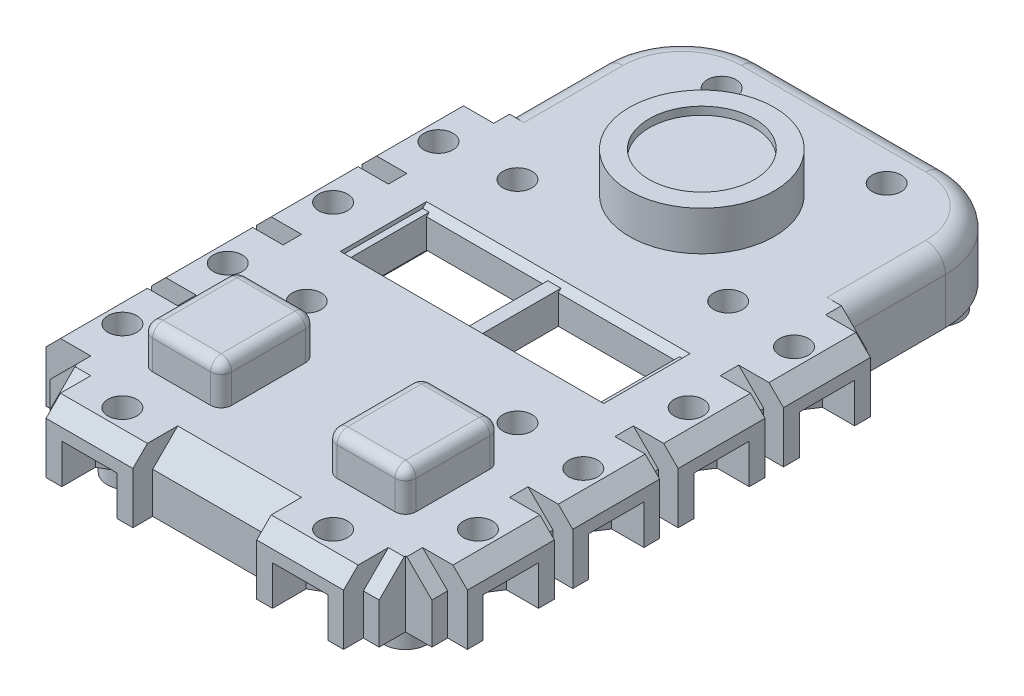
from build123d import *

# Parameters (mm, degrees)
SKETCH1_W            = 32
SKETCH1_H            = 50
BOSS_EXTRUDE1_DEPTH  = 2.5
CUT_EXTRUDE1_DEPTH   = 10
SKETCH5_R            = 1.1
CUT_EXTRUDE2_DEPTH   = 10
CHAMFER1_SIZE        = 1.1
FILLET1_R            = 1.5
CHAMFER2_SIZE        = 1.9
SKETCH6_R            = 1.1
CUT_EXTRUDE3_DEPTH   = 4
SKETCH7_W            = 6
SKETCH7_H            = 7.2
BOSS_EXTRUDE2_DEPTH  = 3
FILLET2_R            = 0.8
SKETCH8_R            = 5.5
BOSS_EXTRUDE3_DEPTH  = 3
SKETCH9_R            = 4
CUT_EXTRUDE4_DEPTH   = 0.6
SKETCH10_W           = 9
SKETCH10_H           = 4.15
CUT_EXTRUDE5_DEPTH   = 31.099833887
SKETCH11_W           = 20
SKETCH11_H           = 4.15
CUT_EXTRUDE6_DEPTH   = 0.3
CHAMFER3_SIZE        = 1.2
CUT_EXTRUDE7_DEPTH   = 1.5
CUT_EXTRUDE8_REACH   = 32.741
LPATTERN1_COUNT      = 4
LPATTERN1_PITCH      = 8
CUT_EXTRUDE9_DEPTH   = 1.55
CUT_EXTRUDE10_REACH  = 32.741
MIRROR2_COPY_1_DEPTH = 1.5
MIRROR2_COPY_2_DEPTH = 1.5
MIRROR2_COPY_3_DEPTH = 1.5
MIRROR2_COPY_4_REACH = 32.741
MIRROR2_COPY_5_REACH = 32.741
MIRROR2_COPY_6_REACH = 32.741
SKETCH16_R           = 1.715
CUT_EXTRUDE11_DEPTH  = 4.5
SKETCH17_R           = 3.25
BOSS_EXTRUDE4_DEPTH  = 3
SKETCH18_W           = 3.4
SKETCH18_H           = 4.6
CUT_EXTRUDE12_DEPTH  = 3
SKETCH20_R           = 3.35
SKETCH20_R_2         = 2.4
BOSS_EXTRUDE5_DEPTH  = 3
SKETCH21_W           = 21
SKETCH21_H           = 8.35
SKETCH21_W_2         = 9
SKETCH21_H_2         = 5.55
BOSS_EXTRUDE6_DEPTH  = 2.2
SKETCH22_R           = 1.65
BOSS_EXTRUDE7_DEPTH  = 6.5
SKETCH23_R           = 1.15
CUT_EXTRUDE13_DEPTH  = 5


with BuildPart() as part:
    # Sketch1 → Boss-Extrude1 (new, symmetric)
    with BuildSketch(Plane(origin=(0, 0, 0), x_dir=(1, 0, 0), z_dir=(0, 1, 0))):
        Rectangle(SKETCH1_W, SKETCH1_H)
    extrude(amount=BOSS_EXTRUDE1_DEPTH, both=True)

    # Sketch4 → Cut-Extrude1 (cut)
    with BuildSketch(Plane(origin=(0, 2.5, 0), x_dir=(1, 0, 0), z_dir=(0, 1, 0))):
        with BuildLine():
            Line((-13, 19), (-13, 11.5))
            Line((-13, 11.5), (-14.5, 11.5))
            Line((-14.5, 11.5), (-14.5, 10.3))
            Line((-14.5, 10.3), (-16, 10.3))
            Line((-16, 10.3), (-16, 3.7))
            Line((-16, 3.7), (-14.5, 3.7))
            Line((-14.5, 3.7), (-14.5, 2.3))
            Line((-14.5, 2.3), (-16, 2.3))
            Line((-16, 2.3), (-16, -4.3))
            Line((-16, -4.3), (-14.5, -4.3))
            Line((-14.5, -4.3), (-14.5, -5.7))
            Line((-14.5, -5.7), (-16, -5.7))
            Line((-16, -5.7), (-16, -12.3))
            Line((-16, -12.3), (-14.5, -12.3))
            Line((-14.5, -12.3), (-14.5, -13.7))
            Line((-14.5, -13.7), (-16, -13.7))
            Line((-16, -13.7), (-16, -20.3))
            Line((-16, -20.3), (-14.5, -20.3))
            Line((-14.5, -20.3), (-14.5, -21.5))
            Line((-14.5, -21.5), (-12.5, -21.5))
            Line((-12.5, -21.5), (-12.5, -23.5))
            Line((-12.5, -23.5), (-11.3, -23.5))
            Line((-11.3, -23.5), (-11.3, -25))
            Line((-11.3, -25), (-4.7, -25))
            Line((-4.7, -25), (-4.7, -23.5))
            Line((-4.7, -23.5), (0, -23.5))
            Line((0, -23.5), (0, -26))
            Line((0, -26), (-20, -26))
            Line((-20, -26), (-20, 25))
            Line((-20, 25), (-7, 25))
            ThreePointArc((-7, 25), (-11.242640687, 23.242640687), (-13, 19))
        make_face()
    cut_extrude1 = extrude(amount=-CUT_EXTRUDE1_DEPTH, mode=Mode.SUBTRACT)

    # Mirror1: Cut-Extrude1 across plane
    add(cut_extrude1.mirror(Plane(origin=(0, 0, 0), x_dir=(0, 0, 1), z_dir=(1, 0, 0))), mode=Mode.SUBTRACT)

    # Sketch5 → Cut-Extrude2 (cut)
    with BuildSketch(Plane(origin=(0, 2.5, 0), x_dir=(1, 0, 0), z_dir=(0, 1, 0))):
        with Locations(Location((-13.5, 7, 0), (0, 0, 270))):
            Circle(SKETCH5_R)
        with Locations(Location((13.5, 7, 0), (0, 0, 270))):
            Circle(SKETCH5_R)
        with Locations(Location((13.5, -1, 0), (0, 0, 270))):
            Circle(SKETCH5_R)
        with Locations(Location((13.5, -9, 0), (0, 0, 270))):
            Circle(SKETCH5_R)
        with Locations(Location((13.5, -17, 0), (0, 0, 270))):
            Circle(SKETCH5_R)
        with Locations(Location((-13.5, -1, 0), (0, 0, 270))):
            Circle(SKETCH5_R)
        with Locations(Location((-13.5, -9, 0), (0, 0, 270))):
            Circle(SKETCH5_R)
        with Locations(Location((-13.5, -17, 0), (0, 0, 270))):
            Circle(SKETCH5_R)
        with Locations(Location((-8, -22.5, 0), (0, 0, 270))):
            Circle(SKETCH5_R)
        with Locations(Location((8, -22.5, 0), (0, 0, 270))):
            Circle(SKETCH5_R)
    extrude(amount=-CUT_EXTRUDE2_DEPTH, mode=Mode.SUBTRACT)

    # Chamfer1
    chamfer1_edges = [part.edges().sort_by_distance(p)[0] for p in [
        (8, 2.5, 25),
        (16, 2.5, 17),
        (16, 2.5, 9),
        (16, 2.5, 1),
        (16, 2.5, -7),
        (-16, 2.5, -7),
        (-16, 2.5, 1),
        (-16, 2.5, 9),
        (-16, 2.5, 17),
        (-8, 2.5, 25),
    ]]
    chamfer(chamfer1_edges, length=CHAMFER1_SIZE)

    # Fillet1
    fillet1_edges = [part.edges().sort_by_distance(p)[0] for p in [
        (0, 2.5, -25),
        (13, 2.5, -15.25),
        (11.242640687, 2.5, -23.242640687),
        (-13, 2.5, -15.25),
        (-11.242640687, 2.5, -23.242640687),
    ]]
    fillet(fillet1_edges, radius=FILLET1_R)

    # Chamfer2
    chamfer2_edges = [part.edges().sort_by_distance(p)[0] for p in [
        (11.9, 2.5, 23.5),
        (14.5, 2.5, 20.9),
        (14.5, 2.5, 13),
        (14.5, 2.5, 5),
        (14.5, 2.5, -3),
        (14.5, 2.5, -10.9),
        (-14.5, 2.5, -10.9),
        (-14.5, 2.5, -3),
        (-14.5, 2.5, 5),
        (-14.5, 2.5, 13),
        (-11.9, 2.5, 23.5),
        (-14.5, 2.5, 20.9),
        (0, 2.5, 23.5),
    ]]
    chamfer(chamfer2_edges, length=CHAMFER2_SIZE)

    # Sketch6 → Cut-Extrude3 (cut)
    with BuildSketch(Plane(origin=(0, 2.5, 0), x_dir=(1, 0, 0), z_dir=(0, 1, 0))):
        with Locations(Location((-6.265, 21.27, 0), (0, 0, 270))):
            Circle(SKETCH6_R)
        with Locations(Location((6.265, 21.27, 0), (0, 0, 270))):
            Circle(SKETCH6_R)
        with Locations(Location((-8, 7.5, 0), (0, 0, 270))):
            Circle(SKETCH6_R)
        with Locations(Location((8, 7.5, 0), (0, 0, 270))):
            Circle(SKETCH6_R)
        with Locations(Location((8, -8.5, 0), (0, 0, 270))):
            Circle(SKETCH6_R)
        with Locations(Location((-8, -8.5, 0), (0, 0, 270))):
            Circle(SKETCH6_R)
    extrude(amount=-CUT_EXTRUDE3_DEPTH, mode=Mode.SUBTRACT)

    # Sketch7 → Boss-Extrude2 (add)
    with BuildSketch(Plane(origin=(0, 2.5, 0), x_dir=(1, 0, 0), z_dir=(0, 1, 0))):
        with Locations((-7, -15.4)):
            Rectangle(SKETCH7_W, SKETCH7_H)
        with Locations((7, -15.4)):
            Rectangle(SKETCH7_W, SKETCH7_H)
    extrude(amount=BOSS_EXTRUDE2_DEPTH)

    # Fillet2
    fillet2_edges = [part.edges().sort_by_distance(p)[0] for p in [
        (-10, 4, 11.8),
        (-10, 4, 19),
        (-4, 4, 19),
        (-4, 4, 11.8),
        (-10, 5.5, 15.4),
        (-7, 5.5, 19),
        (-4, 5.5, 15.4),
        (-7, 5.5, 11.8),
        (4, 4, 11.8),
        (4, 4, 19),
        (10, 4, 19),
        (10, 4, 11.8),
        (4, 5.5, 15.4),
        (7, 5.5, 19),
        (10, 5.5, 15.4),
        (7, 5.5, 11.8),
    ]]
    fillet(fillet2_edges, radius=FILLET2_R)

    # Sketch8 → Boss-Extrude3 (add)
    with BuildSketch(Plane(origin=(0, 2.5, 0), x_dir=(1, 0, 0), z_dir=(0, 1, 0))):
        with Locations(Location((0, 13.5, 0), (0, 0, 90))):
            Circle(SKETCH8_R)
    extrude(amount=BOSS_EXTRUDE3_DEPTH)

    # Sketch9 → Cut-Extrude4 (cut)
    with BuildSketch(Plane(origin=(0, 5.5, 0), x_dir=(1, 0, 0), z_dir=(0, 1, 0))):
        with Locations(Location((0, 13.5, 0), (0, 0, 270))):
            Circle(SKETCH9_R)
    extrude(amount=-CUT_EXTRUDE4_DEPTH, mode=Mode.SUBTRACT)

    # Sketch10 → Cut-Extrude5 (cut, through all)
    with BuildSketch(Plane(origin=(0, 2.5, 0), x_dir=(1, 0, 0), z_dir=(0, 1, 0))):
        with Locations((-5, -0.675)):
            Rectangle(SKETCH10_W, SKETCH10_H)
        with Locations((5, -0.675)):
            Rectangle(SKETCH10_W, SKETCH10_H)
    extrude(amount=-CUT_EXTRUDE5_DEPTH, mode=Mode.SUBTRACT)

    # Sketch11 → Cut-Extrude6 (cut)
    with BuildSketch(Plane(origin=(0, 2.5, 0), x_dir=(1, 0, 0), z_dir=(0, 1, 0))):
        with Locations((0, -0.675)):
            Rectangle(SKETCH11_W, SKETCH11_H)
    extrude(amount=-CUT_EXTRUDE6_DEPTH, mode=Mode.SUBTRACT)

    # Chamfer3
    # the kernel refuses this chamfer: 1.2 mm, written as the material it takes off along each edge
    with BuildSketch(Plane(origin=(10, 2.5, 2.75), x_dir=(0, 0.027495876610586275, 0.9996219169112968), z_dir=(-1, 0, 0))) as chamfer3_piece_1_section:
        Polygon((CHAMFER3_SIZE * 0.999621916911, -CHAMFER3_SIZE * 0.0274958766106), (-CHAMFER3_SIZE * 0.0274958766106, -CHAMFER3_SIZE * 0.999621916911), (0, 0), align=None)
    chamfer3_piece_1 = extrude(amount=20, mode=Mode.PRIVATE)
    chamfer3_piece_1 = split(chamfer3_piece_1, bisect_by=Plane(origin=(9.75, 2.2, 3.278571429), z_dir=(0, 1, 0)), keep=Keep.TOP, mode=Mode.PRIVATE)
    add(chamfer3_piece_1, mode=Mode.SUBTRACT)
    with BuildSketch(Plane(origin=(13.086019586, 2.5, 2.75), x_dir=(0, 0.027495876610586275, 0.9996219169112968), z_dir=(-1, 0, 0))) as chamfer3_piece_2_section:
        Polygon((CHAMFER3_SIZE * 0.999621916911, -CHAMFER3_SIZE * 0.0274958766106), (-CHAMFER3_SIZE * 0.0274958766106, -CHAMFER3_SIZE * 0.999621916911), (0, 0), align=None)
    chamfer3_piece_2 = extrude(amount=26.172039171, mode=Mode.PRIVATE)
    chamfer3_piece_2 = split(chamfer3_piece_2, bisect_by=Plane(origin=(9.5, 1.9, 3.05), z_dir=(-1, 0, 0)), keep=Keep.TOP, mode=Mode.PRIVATE)
    chamfer3_piece_2 = split(chamfer3_piece_2, bisect_by=Plane(origin=(0.5, 1.9, 3.05), z_dir=(1, 0, 0)), keep=Keep.TOP, mode=Mode.PRIVATE)
    add(chamfer3_piece_2, mode=Mode.SUBTRACT)
    with BuildSketch(Plane(origin=(13.086019586, 2.5, 2.75), x_dir=(0, 0.027495876610586275, 0.9996219169112968), z_dir=(-1, 0, 0))) as chamfer3_piece_3_section:
        Polygon((CHAMFER3_SIZE * 0.999621916911, -CHAMFER3_SIZE * 0.0274958766106), (-CHAMFER3_SIZE * 0.0274958766106, -CHAMFER3_SIZE * 0.999621916911), (0, 0), align=None)
    chamfer3_piece_3 = extrude(amount=26.172039171, mode=Mode.PRIVATE)
    chamfer3_piece_3 = split(chamfer3_piece_3, bisect_by=Plane(origin=(-0.5, 1.9, 3.05), z_dir=(-1, 0, 0)), keep=Keep.TOP, mode=Mode.PRIVATE)
    chamfer3_piece_3 = split(chamfer3_piece_3, bisect_by=Plane(origin=(-9.5, 1.9, 3.05), z_dir=(1, 0, 0)), keep=Keep.TOP, mode=Mode.PRIVATE)
    add(chamfer3_piece_3, mode=Mode.SUBTRACT)
    with BuildSketch(Plane(origin=(-10, 2.5, -1.4), x_dir=(0, 0.027495876610586275, -0.9996219169112968), z_dir=(1, 0, 0))) as chamfer3_piece_4_section:
        Polygon((CHAMFER3_SIZE * 0.999621916911, -CHAMFER3_SIZE * 0.0274958766106), (-CHAMFER3_SIZE * 0.0274958766106, -CHAMFER3_SIZE * 0.999621916911), (0, 0), align=None)
    chamfer3_piece_4 = extrude(amount=20, mode=Mode.PRIVATE)
    chamfer3_piece_4 = split(chamfer3_piece_4, bisect_by=Plane(origin=(-9.75, 2.2, -2.4), z_dir=(0, 1, 0)), keep=Keep.TOP, mode=Mode.PRIVATE)
    add(chamfer3_piece_4, mode=Mode.SUBTRACT)
    with BuildSketch(Plane(origin=(-13.086019586, 2.5, -1.4), x_dir=(0, 0.027495876610586275, -0.9996219169112968), z_dir=(1, 0, 0))) as chamfer3_piece_5_section:
        Polygon((CHAMFER3_SIZE * 0.999621916911, -CHAMFER3_SIZE * 0.0274958766106), (-CHAMFER3_SIZE * 0.0274958766106, -CHAMFER3_SIZE * 0.999621916911), (0, 0), align=None)
    chamfer3_piece_5 = extrude(amount=26.172039171, mode=Mode.PRIVATE)
    chamfer3_piece_5 = split(chamfer3_piece_5, bisect_by=Plane(origin=(-0.5, 1.9, -1.7), z_dir=(-1, 0, 0)), keep=Keep.TOP, mode=Mode.PRIVATE)
    chamfer3_piece_5 = split(chamfer3_piece_5, bisect_by=Plane(origin=(-9.5, 1.9, -1.7), z_dir=(1, 0, 0)), keep=Keep.TOP, mode=Mode.PRIVATE)
    add(chamfer3_piece_5, mode=Mode.SUBTRACT)
    with BuildSketch(Plane(origin=(-13.086019586, 2.5, -1.4), x_dir=(0, 0.027495876610586275, -0.9996219169112968), z_dir=(1, 0, 0))) as chamfer3_piece_6_section:
        Polygon((CHAMFER3_SIZE * 0.999621916911, -CHAMFER3_SIZE * 0.0274958766106), (-CHAMFER3_SIZE * 0.0274958766106, -CHAMFER3_SIZE * 0.999621916911), (0, 0), align=None)
    chamfer3_piece_6 = extrude(amount=26.172039171, mode=Mode.PRIVATE)
    chamfer3_piece_6 = split(chamfer3_piece_6, bisect_by=Plane(origin=(9.5, 1.9, -1.7), z_dir=(-1, 0, 0)), keep=Keep.TOP, mode=Mode.PRIVATE)
    chamfer3_piece_6 = split(chamfer3_piece_6, bisect_by=Plane(origin=(0.5, 1.9, -1.7), z_dir=(1, 0, 0)), keep=Keep.TOP, mode=Mode.PRIVATE)
    add(chamfer3_piece_6, mode=Mode.SUBTRACT)

    # Sketch12 → Cut-Extrude7 (cut)
    with BuildSketch(Plane(origin=(0, 0.5, 0), x_dir=(1, 0, 0), z_dir=(0, 1, 0))):
        Polygon((-12.287564435, 9.1), (-14.712435565, 9.1), (-17.712435565, 9.1), (-17.712435565, 4.9), (-14.712435565, 4.9), (-12.287564435, 4.9), (-11.075128869, 7), align=None)
    cut_extrude7 = extrude(amount=-CUT_EXTRUDE7_DEPTH, mode=Mode.SUBTRACT)

    # Sketch13 → Cut-Extrude8 (cut, up to next)
    with BuildSketch(Plane.XZ.offset(2.5), mode=Mode.PRIVATE) as cut_extrude8_sk1:
        with BuildLine():
            Line((-16, -4.9), (-13.442264973, -4.9))
            Line((-13.442264973, -4.9), (-12.547372056, -6.45))
            ThreePointArc((-12.547372056, -6.45), (-12.400415486, -7.030230734), (-12.579030386, -7.601510574))
            Line((-12.579030386, -7.601510574), (-13.557735027, -9.1))
            Line((-13.557735027, -9.1), (-16, -9.1))
            Line((-16, -9.1), (-16, -4.9))
        make_face()
    cut_extrude8_tool1 = extrude(cut_extrude8_sk1.sketch, amount=-CUT_EXTRUDE8_REACH, mode=Mode.PRIVATE) & part.part
    cut_extrude8 = cut_extrude8_tool1.solids().sort_by_distance((-14.416857, -2.5, -6.989337))[0]
    add(cut_extrude8, mode=Mode.SUBTRACT)

    # LPattern1: Cut-Extrude7, Cut-Extrude8 ×4
    with Locations(*[(0, 0, i * LPATTERN1_PITCH) for i in range(1, LPATTERN1_COUNT)]):
        add(cut_extrude7, mode=Mode.SUBTRACT)
        add(cut_extrude8, mode=Mode.SUBTRACT)

    # Sketch14 → Cut-Extrude9 (cut)
    with BuildSketch(Plane(origin=(0, 0.5, 0), x_dir=(1, 0, 0), z_dir=(0, 1, 0))):
        Polygon((-5.9, -23.712435565), (-5.9, -21.287564435), (-8, -20.075128869), (-10.1, -21.287564435), (-10.1, -23.712435565), (-10.1, -26.712435565), (-5.9, -26.712435565), align=None)
    cut_extrude9 = extrude(amount=-CUT_EXTRUDE9_DEPTH, mode=Mode.SUBTRACT)

    # Sketch15 → Cut-Extrude10 (cut, up to next)
    with BuildSketch(Plane.XZ.offset(2.5), mode=Mode.PRIVATE) as cut_extrude10_sk1:
        with BuildLine():
            Line((-10.1, 25), (-5.9, 25))
            Line((-5.9, 25), (-5.9, 22.442264973))
            Line((-5.9, 22.442264973), (-7.45, 21.547372056))
            ThreePointArc((-7.45, 21.547372056), (-8, 21.4), (-8.55, 21.547372056))
            Line((-8.55, 21.547372056), (-10.1, 22.442264973))
            Line((-10.1, 22.442264973), (-10.1, 25))
        make_face()
    cut_extrude10_tool1 = extrude(cut_extrude10_sk1.sketch, amount=-CUT_EXTRUDE10_REACH, mode=Mode.PRIVATE) & part.part
    cut_extrude10 = cut_extrude10_tool1.solids().sort_by_distance((-8, -2.5, 23.408677))[0]
    add(cut_extrude10, mode=Mode.SUBTRACT)

    # Mirror2: Cut-Extrude7, Cut-Extrude8, Cut-Extrude9, Cut-Extrude10 across plane
    add(cut_extrude7.mirror(Plane(origin=(0, 0, 0), x_dir=(0, 0, 1), z_dir=(1, 0, 0))), mode=Mode.SUBTRACT)
    add(cut_extrude8.mirror(Plane(origin=(0, 0, 0), x_dir=(0, 0, 1), z_dir=(1, 0, 0))), mode=Mode.SUBTRACT)
    add(cut_extrude9.mirror(Plane(origin=(0, 0, 0), x_dir=(0, 0, 1), z_dir=(1, 0, 0))), mode=Mode.SUBTRACT)
    add(cut_extrude10.mirror(Plane(origin=(0, 0, 0), x_dir=(0, 0, 1), z_dir=(1, 0, 0))), mode=Mode.SUBTRACT)

    # Mirror2 copy 1 sketch → Mirror2 copy 1 (cut)
    with BuildSketch(Plane(origin=(0, 0.5, 8), x_dir=(-1, 0, 0), z_dir=(0, 1, 0))):
        Polygon((-12.287564435, -9.1), (-14.712435565, -9.1), (-17.712435565, -9.1), (-17.712435565, -4.9), (-14.712435565, -4.9), (-12.287564435, -4.9), (-11.075128869, -7), align=None)
    extrude(amount=-MIRROR2_COPY_1_DEPTH, mode=Mode.SUBTRACT)

    # Mirror2 copy 2 sketch → Mirror2 copy 2 (cut)
    with BuildSketch(Plane(origin=(0, 0.5, 16), x_dir=(-1, 0, 0), z_dir=(0, 1, 0))):
        Polygon((-12.287564435, -9.1), (-14.712435565, -9.1), (-17.712435565, -9.1), (-17.712435565, -4.9), (-14.712435565, -4.9), (-12.287564435, -4.9), (-11.075128869, -7), align=None)
    extrude(amount=-MIRROR2_COPY_2_DEPTH, mode=Mode.SUBTRACT)

    # Mirror2 copy 3 sketch → Mirror2 copy 3 (cut)
    with BuildSketch(Plane(origin=(0, 0.5, 24), x_dir=(-1, 0, 0), z_dir=(0, 1, 0))):
        Polygon((-12.287564435, -9.1), (-14.712435565, -9.1), (-17.712435565, -9.1), (-17.712435565, -4.9), (-14.712435565, -4.9), (-12.287564435, -4.9), (-11.075128869, -7), align=None)
    extrude(amount=-MIRROR2_COPY_3_DEPTH, mode=Mode.SUBTRACT)

    # Mirror2 copy 4 sketch → Mirror2 copy 4 (cut, up to next)
    with BuildSketch(Plane(origin=(0, -2.5, 8), x_dir=(-1, 0, 0), z_dir=(0, -1, 0)), mode=Mode.PRIVATE) as mirror2_copy_4_sk1:
        with BuildLine():
            Line((-16, 4.9), (-13.442264973, 4.9))
            Line((-13.442264973, 4.9), (-12.547372056, 6.45))
            ThreePointArc((-12.547372056, 6.45), (-12.400415486, 7.030230734), (-12.579030386, 7.601510574))
            Line((-12.579030386, 7.601510574), (-13.557735027, 9.1))
            Line((-13.557735027, 9.1), (-16, 9.1))
            Line((-16, 9.1), (-16, 4.9))
        make_face()
    mirror2_copy_4_tool1 = extrude(mirror2_copy_4_sk1.sketch, amount=-MIRROR2_COPY_4_REACH, mode=Mode.PRIVATE) & part.part
    add(mirror2_copy_4_tool1.solids().sort_by_distance((14.416857, -2.5, 1.010663))[0], mode=Mode.SUBTRACT)

    # Mirror2 copy 5 sketch → Mirror2 copy 5 (cut, up to next)
    with BuildSketch(Plane(origin=(0, -2.5, 16), x_dir=(-1, 0, 0), z_dir=(0, -1, 0)), mode=Mode.PRIVATE) as mirror2_copy_5_sk1:
        with BuildLine():
            Line((-16, 4.9), (-13.442264973, 4.9))
            Line((-13.442264973, 4.9), (-12.547372056, 6.45))
            ThreePointArc((-12.547372056, 6.45), (-12.400415486, 7.030230734), (-12.579030386, 7.601510574))
            Line((-12.579030386, 7.601510574), (-13.557735027, 9.1))
            Line((-13.557735027, 9.1), (-16, 9.1))
            Line((-16, 9.1), (-16, 4.9))
        make_face()
    mirror2_copy_5_tool1 = extrude(mirror2_copy_5_sk1.sketch, amount=-MIRROR2_COPY_5_REACH, mode=Mode.PRIVATE) & part.part
    add(mirror2_copy_5_tool1.solids().sort_by_distance((14.416857, -2.5, 9.010663))[0], mode=Mode.SUBTRACT)

    # Mirror2 copy 6 sketch → Mirror2 copy 6 (cut, up to next)
    with BuildSketch(Plane(origin=(0, -2.5, 24), x_dir=(-1, 0, 0), z_dir=(0, -1, 0)), mode=Mode.PRIVATE) as mirror2_copy_6_sk1:
        with BuildLine():
            Line((-16, 4.9), (-13.442264973, 4.9))
            Line((-13.442264973, 4.9), (-12.547372056, 6.45))
            ThreePointArc((-12.547372056, 6.45), (-12.400415486, 7.030230734), (-12.579030386, 7.601510574))
            Line((-12.579030386, 7.601510574), (-13.557735027, 9.1))
            Line((-13.557735027, 9.1), (-16, 9.1))
            Line((-16, 9.1), (-16, 4.9))
        make_face()
    mirror2_copy_6_tool1 = extrude(mirror2_copy_6_sk1.sketch, amount=-MIRROR2_COPY_6_REACH, mode=Mode.PRIVATE) & part.part
    add(mirror2_copy_6_tool1.solids().sort_by_distance((14.416857, -2.5, 17.010663))[0], mode=Mode.SUBTRACT)

    # Sketch16 → Cut-Extrude11 (cut)
    with BuildSketch(Plane.XZ.offset(2.5)):
        with BuildLine():
            Line((-11.74, 19.1), (11.74, 19.1))
            Line((11.74, 19.1), (11.74, -17.74))
            ThreePointArc((11.74, -17.74), (9.982640687, -21.982640687), (5.74, -23.74))
            Line((5.74, -23.74), (-5.74, -23.74))
            ThreePointArc((-5.74, -23.74), (-9.982640687, -21.982640687), (-11.74, -17.74))
            Line((-11.74, -17.74), (-11.74, 19.1))
        make_face()
        with Locations(Location((-8, 8.5, 0), (0, 0, 270))):
            Circle(SKETCH16_R, mode=Mode.SUBTRACT)
        with Locations(Location((8, 8.5, 0), (0, 0, 270))):
            Circle(SKETCH16_R, mode=Mode.SUBTRACT)
        with Locations(Location((-6.265, -21.27, 0), (0, 0, 270))):
            Circle(SKETCH16_R, mode=Mode.SUBTRACT)
        with Locations(Location((6.265, -21.27, 0), (0, 0, 270))):
            Circle(SKETCH16_R, mode=Mode.SUBTRACT)
        with Locations(Location((8, -7.5, 0), (0, 0, 270))):
            Circle(SKETCH16_R, mode=Mode.SUBTRACT)
        with Locations(Location((-8, -7.5, 0), (0, 0, 270))):
            Circle(SKETCH16_R, mode=Mode.SUBTRACT)
    extrude(amount=-CUT_EXTRUDE11_DEPTH, mode=Mode.SUBTRACT)

    # Sketch17 → Boss-Extrude4 (add)
    with BuildSketch(Plane.XZ.offset(-2)):
        with Locations(Location((0, -13.5, 0), (0, 0, 90))):
            Circle(SKETCH17_R)
    extrude(amount=BOSS_EXTRUDE4_DEPTH)

    # Sketch18 → Cut-Extrude12 (cut)
    with BuildSketch(Plane.XZ.offset(-2)):
        with Locations((7, 15.4)):
            Rectangle(SKETCH18_W, SKETCH18_H)
        with Locations((-7, 15.4)):
            Rectangle(SKETCH18_W, SKETCH18_H)
    extrude(amount=-CUT_EXTRUDE12_DEPTH, mode=Mode.SUBTRACT)

    # Sketch20 → Boss-Extrude5 (add)
    with BuildSketch(Plane.XZ.offset(-2)):
        with Locations(Location((0, 13.6, 0), (0, 0, 90))):
            Circle(SKETCH20_R)
        with Locations(Location((0, 13.6, 0), (0, 0, 270))):
            Circle(SKETCH20_R_2, mode=Mode.SUBTRACT)
    extrude(amount=BOSS_EXTRUDE5_DEPTH)

    # Sketch21 → Boss-Extrude6 (add)
    with BuildSketch(Plane.XZ.offset(-2)):
        with Locations((0, 0.675)):
            Rectangle(SKETCH21_W, SKETCH21_H)
        with Locations((5, 0.675)):
            Rectangle(SKETCH21_W_2, SKETCH21_H_2, mode=Mode.SUBTRACT)
        with Locations((-5, 0.675)):
            Rectangle(SKETCH21_W_2, SKETCH21_H_2, mode=Mode.SUBTRACT)
    extrude(amount=BOSS_EXTRUDE6_DEPTH)

    # Sketch22 → Boss-Extrude7 (add)
    with BuildSketch(Plane.XZ.offset(-2)):
        with Locations(Location((-10.5, 19.5, 0), (0, 0, 345.970334599))):
            Circle(SKETCH22_R)
        with Locations(Location((10.5, 19.5, 0), (0, 0, 194.029665401))):
            Circle(SKETCH22_R)
        with Locations(Location((9.5, -22, 0), (0, 0, 38.398999159))):
            Circle(SKETCH22_R)
        with Locations(Location((-9.5, -22, 0), (0, 0, 141.601000841))):
            Circle(SKETCH22_R)
    extrude(amount=BOSS_EXTRUDE7_DEPTH)

    # Sketch23 → Cut-Extrude13 (cut)
    with BuildSketch(Plane.XZ.offset(4.5)):
        with Locations(Location((10.5, 19.5, 0), (0, 0, 270))):
            Circle(SKETCH23_R)
        with Locations(Location((-10.5, 19.5, 0), (0, 0, 270))):
            Circle(SKETCH23_R)
        with Locations(Location((9.5, -22, 0), (0, 0, 270))):
            Circle(SKETCH23_R)
        with Locations(Location((-9.5, -22, 0), (0, 0, 270))):
            Circle(SKETCH23_R)
    extrude(amount=-CUT_EXTRUDE13_DEPTH, mode=Mode.SUBTRACT)


solid = part.part
